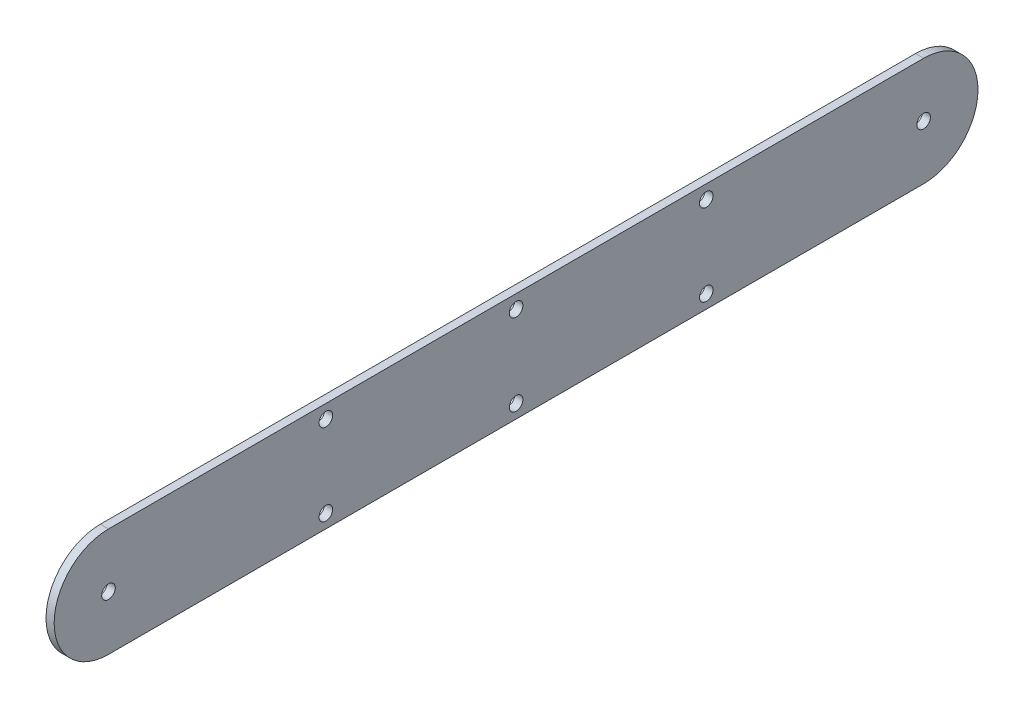
from build123d import *

# Parameters (mm, degrees)
SKETCH1_R           = 2.5
BOSS_EXTRUDE1_DEPTH = 3


with BuildPart() as part:
    # Sketch1 → Boss-Extrude1 (new body)
    with BuildSketch(Plane(origin=(0, 0, 0), x_dir=(0, 0, -1), z_dir=(1, 0, 0))):
        with BuildLine():
            Line((-150, -20), (150, -20))
            ThreePointArc((150, -20), (170, 0), (150, 20))
            Line((150, 20), (-150, 20))
            ThreePointArc((-150, 20), (-170, 0), (-150, -20))
        make_face()
        with Locations((150, 0)):
            Circle(SKETCH1_R, mode=Mode.SUBTRACT)
        with Locations((-150, 0)):
            Circle(SKETCH1_R, mode=Mode.SUBTRACT)
        with Locations((70, 15)):
            Circle(SKETCH1_R, mode=Mode.SUBTRACT)
        with Locations((70, -15)):
            Circle(SKETCH1_R, mode=Mode.SUBTRACT)
        with Locations((-70, 15)):
            Circle(SKETCH1_R, mode=Mode.SUBTRACT)
        with Locations((-70, -15)):
            Circle(SKETCH1_R, mode=Mode.SUBTRACT)
        with Locations((0, 15)):
            Circle(SKETCH1_R, mode=Mode.SUBTRACT)
        with Locations((0, -15)):
            Circle(SKETCH1_R, mode=Mode.SUBTRACT)
    extrude(amount=BOSS_EXTRUDE1_DEPTH)


solid = part.part
